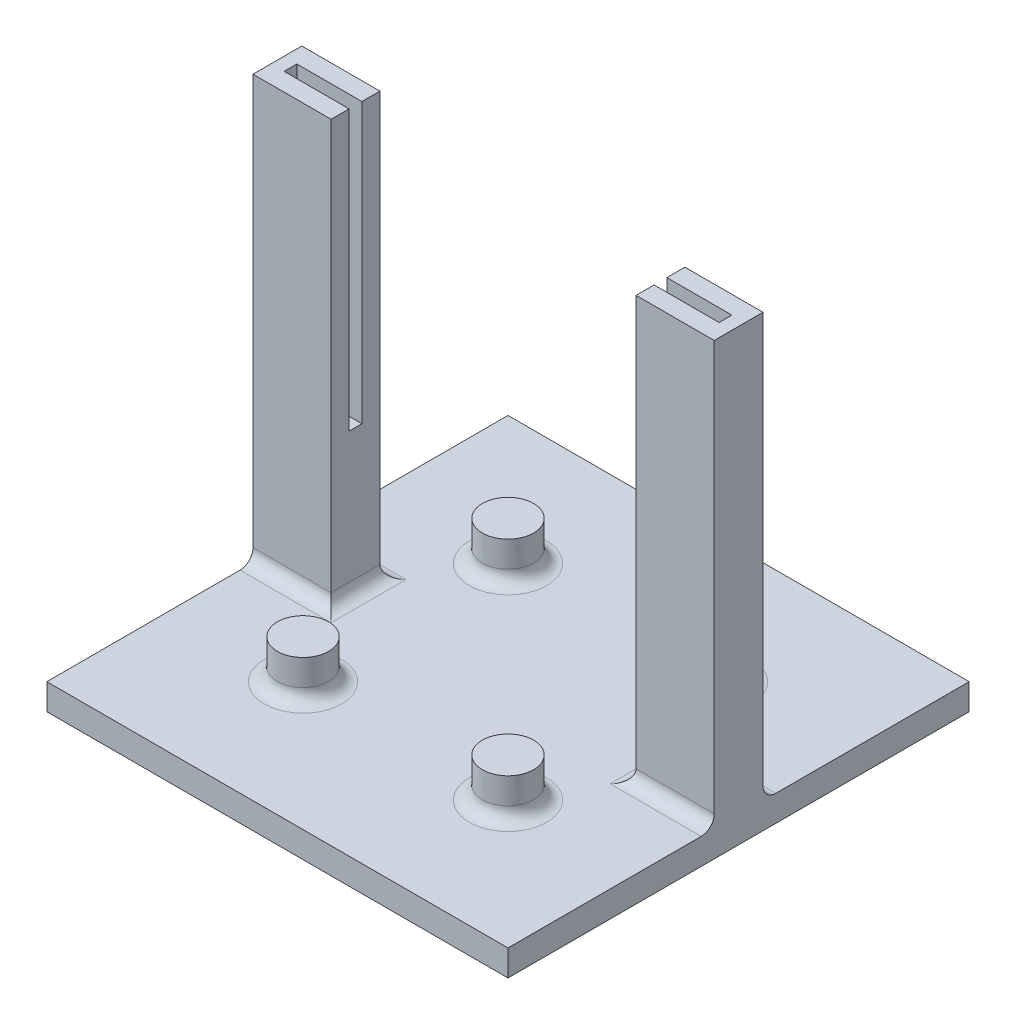
from build123d import *

# Parameters (mm, degrees)
SKETCH1_W           = 45
SKETCH1_H           = 45
BOSS_EXTRUDE1_DEPTH = 2.54
SKETCH2_R           = 2.5
BOSS_EXTRUDE2_DEPTH = 3.81
SKETCH3_W           = 7.62
SKETCH3_H           = 4.7625
BOSS_EXTRUDE3_DEPTH = 41.275
SKETCH4_W           = 42.4434
SKETCH4_H           = 1.2446
CUT_EXTRUDE1_DEPTH  = 27.2288
FILLET1_R           = 1.27


with BuildPart() as part:
    # Sketch1 → Boss-Extrude1 (new body)
    with BuildSketch(Plane(origin=(0, 0, 0), x_dir=(1, 0, 0), z_dir=(0, 1, 0))):
        Rectangle(SKETCH1_W, SKETCH1_H)
    extrude(amount=-BOSS_EXTRUDE1_DEPTH)

    # Sketch2 → Boss-Extrude2 (add)
    with BuildSketch(Plane(origin=(0, 0, 0), x_dir=(1, 0, 0), z_dir=(0, 1, 0))):
        with Locations((-10, 10)):
            Circle(SKETCH2_R)
        with Locations((10, 10)):
            Circle(SKETCH2_R)
        with Locations((10, -10)):
            Circle(SKETCH2_R)
        with Locations((-10, -10)):
            Circle(SKETCH2_R)
    extrude(amount=BOSS_EXTRUDE2_DEPTH)

    # Sketch3 → Boss-Extrude3 (add)
    with BuildSketch(Plane(origin=(0, 0, 0), x_dir=(1, 0, 0), z_dir=(0, 1, 0))):
        with Locations((-18.69, 0)):
            Rectangle(SKETCH3_W, SKETCH3_H)
        with Locations((18.69, 0)):
            Rectangle(SKETCH3_W, SKETCH3_H)
    extrude(amount=BOSS_EXTRUDE3_DEPTH)

    # Sketch4 → Cut-Extrude1 (cut)
    with BuildSketch(Plane(origin=(0, 41.275, 0), x_dir=(1, 0, 0), z_dir=(0, 1, 0))):
        Rectangle(SKETCH4_W, SKETCH4_H)
    extrude(amount=-CUT_EXTRUDE1_DEPTH, mode=Mode.SUBTRACT)

    # Fillet1
    fillet1_edges = [part.edges().sort_by_distance(p)[0] for p in [
        (-12.5, 0, -10),
        (7.5, 0, -10),
        (7.5, 0, 10),
        (-12.5, 0, 10),
        (14.88, 0, 0),
        (18.69, 0, -2.38125),
        (18.69, 0, 2.38125),
        (-18.69, 0, -2.38125),
        (-18.69, 0, 2.38125),
        (-14.88, 0, 0),
    ]]
    fillet(fillet1_edges, radius=FILLET1_R)


solid = part.part
